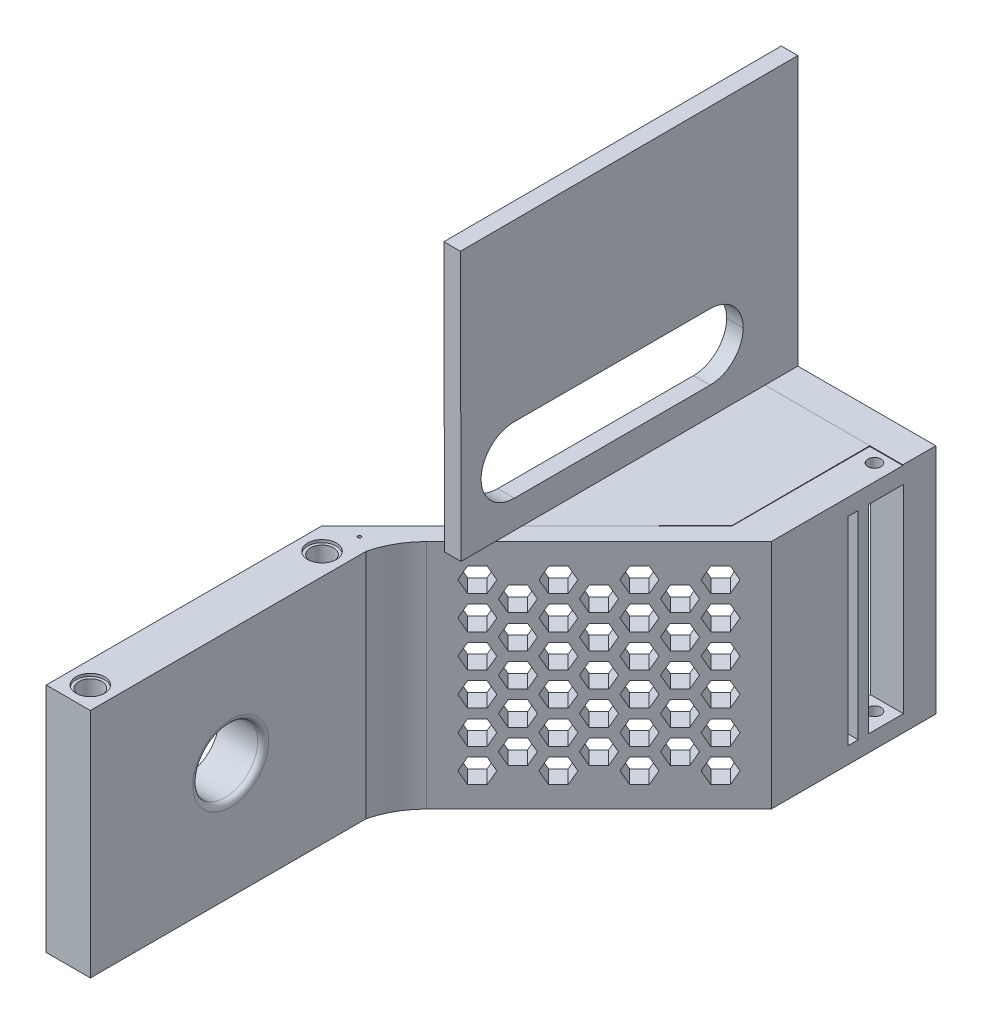
from build123d import *

# Parameters (mm, degrees)
SKETCH1_W            = 25
SKETCH1_H            = 50
SKETCH1_R            = 3.4
BOSS_EXTRUDE1_DEPTH  = 3
SKETCH2_W            = 50
SKETCH2_H            = 3
BOSS_EXTRUDE2_DEPTH  = 8
SKETCH3_W            = 8
SKETCH3_H            = 50
BOSS_EXTRUDE3_DEPTH  = 42
SKETCH4_R            = 2.65
CUT_EXTRUDE1_DEPTH   = 0.5
SKETCH5_R            = 5.888972746
CUT_EXTRUDE2_DEPTH   = 9
FILLET2_R            = 1
SKETCH6_R            = 12.6
BOSS_EXTRUDE4_DEPTH  = 2
FILLET4_R            = 1
SKETCH8_R            = 1.589780168
SKETCH8_R_2          = 1.777428262
CUT_EXTRUDE3_DEPTH   = 10
SKETCH9_W            = 49.021678163
SKETCH9_H            = 20.976854622
CUT_EXTRUDE4_DEPTH   = 68.79439129
SKETCH11_R           = 2.1
CUT_EXTRUDE5_DEPTH   = 59.480168703
SKETCH14_R           = 2.6
CUT_EXTRUDE6_DEPTH   = 0.5
BOSS_EXTRUDE5_DEPTH  = 42
FILLET5_R            = 15
BOSS_EXTRUDE6_DEPTH  = 42
SKETCH17_W           = 55.081474993
SKETCH17_H           = 48.753311723
BOSS_EXTRUDE7_DEPTH  = 3
BOSS_EXTRUDE8_DEPTH  = 2
FILL_START           = -39.593416363
FILL_PATTERN1_DEPTH  = 4.479865946
SKETCH27_W           = 7.5
SKETCH27_H           = 36
CUT_EXTRUDE11_DEPTH  = 117.155303663
SKETCH28_R           = 1.2
CUT_EXTRUDE12_DEPTH  = 113.83644218
SKETCH29_W           = 6
SKETCH29_H           = 42
BOSS_EXTRUDE11_DEPTH = 5.87
CHAMFER1_SIZE        = 4
SKETCH30_R           = 0.3
CUT_EXTRUDE13_DEPTH  = 118.999595961
SKETCH31_W           = 1.8
SKETCH31_H           = 36
CUT_EXTRUDE14_DEPTH  = 10
BOSS_EXTRUDE13_REACH = 132.206
SKETCH33_W           = 28
SKETCH33_H           = 1.999994694
BOSS_EXTRUDE14_REACH = 126.717
SKETCH34_W           = 3
SKETCH34_H           = 48.753311723
SKETCH35_W           = 54.914706507
SKETCH35_H           = 12
CUT_EXTRUDE15_DEPTH  = 4
SKETCH36_W           = 3
SKETCH36_H           = 12
BOSS_EXTRUDE15_DEPTH = 7.4
FILLET6_R            = 6


# Read off the part's stored shape, not the designer's step: Fill Pattern1
# Some blends are built 0.0001 mm under size
with BuildPart() as part:
    # Sketch1 → Boss-Extrude1 (new body)
    with BuildSketch(Plane(origin=(0, 0, 0), x_dir=(1, 0, 0), z_dir=(0, 1, 0))):
        with Locations((2.276951673, 11.384758364)):
            Rectangle(SKETCH1_W, SKETCH1_H)
        with Locations(Location((1.276951673, 11.384758364, 0), (0, 0, 270))):
            Circle(SKETCH1_R, mode=Mode.SUBTRACT)
    extrude(amount=BOSS_EXTRUDE1_DEPTH)

    # Sketch2 → Boss-Extrude2 (add)
    with BuildSketch(Plane.ZY.offset(10.223048327)):
        with Locations((-11.384758364, 1.5)):
            Rectangle(SKETCH2_W, SKETCH2_H)
    extrude(amount=BOSS_EXTRUDE2_DEPTH)

    # Sketch3 → Boss-Extrude3 (add)
    with BuildSketch(Plane.XZ):
        with Locations((-14.223048327, -11.384758364)):
            Rectangle(SKETCH3_W, SKETCH3_H)
    extrude(amount=BOSS_EXTRUDE3_DEPTH)

    # Sketch4 → Cut-Extrude1 (cut)
    with BuildSketch(Plane(origin=(0, 3, 0), x_dir=(1, 0, 0), z_dir=(0, 1, 0))):
        with Locations(Location((-14.223048327, 32.384758364, 0), (0, 0, 270))):
            Circle(SKETCH4_R)
        with Locations(Location((-14.223048327, -9.615241636, 0), (0, 0, 270))):
            Circle(SKETCH4_R)
    cut_extrude1 = extrude(amount=-CUT_EXTRUDE1_DEPTH, mode=Mode.SUBTRACT)

    # Mirror1: Cut-Extrude1 across plane
    add(cut_extrude1.mirror(Plane.ZX.offset(-19.5)), mode=Mode.SUBTRACT)

    # Sketch5 → Cut-Extrude2 (cut)
    with BuildSketch(Plane.ZY.offset(18.223048327)):
        with Locations((-11.836279124, -21)):
            Circle(SKETCH5_R)
    extrude(amount=-CUT_EXTRUDE2_DEPTH, mode=Mode.SUBTRACT)

    # Fillet2
    fillet2_edges = [part.edges().sort_by_distance(p)[0] for p in [
        (-10.223048327, -21, -17.72525187),
    ]]
    fillet(fillet2_edges, radius=FILLET2_R)

    # Mirror2: Cut-Extrude1 across plane
    add(cut_extrude1.mirror(Plane.ZY.offset(1.723048327)), mode=Mode.SUBTRACT)

    # Sketch6 → Boss-Extrude4 (add)
    with BuildSketch(Plane(origin=(0, 3, 0), x_dir=(1, 0, 0), z_dir=(0, 1, 0))):
        with BuildLine():
            Line((14.776951673, 5.825082115), (14.776951673, 16.944434614))
            ThreePointArc((14.776951673, 16.944434614), (-13.323048327, 11.384758364), (14.776951673, 5.825082115))
        make_face()
        with Locations(Location((1.276951673, 11.384758364, 0), (0, 0, 270))):
            Circle(SKETCH6_R, mode=Mode.SUBTRACT)
    extrude(amount=BOSS_EXTRUDE4_DEPTH)

    # Fillet4
    # the kernel refuses this fillet: 1 mm, written as the material it takes off along each edge
    with BuildSketch(Plane(origin=(14.776951673, 5, -3.325082115), x_dir=(0, -1, 0), z_dir=(0, 0, -1))) as fillet4_piece_1:
        with BuildLine():
            CenterArc((FILLET4_R, FILLET4_R), FILLET4_R, 180, 90)
            Line((0, FILLET4_R), (0, 0))
            Line((0, 0), (FILLET4_R, 0))
        make_face()
    extrude(amount=16.119352499, mode=Mode.SUBTRACT)

    # Sketch8 → Cut-Extrude3 (cut)
    with BuildSketch(Plane(origin=(0, 3, 0), x_dir=(1, 0, 0), z_dir=(0, 1, 0))):
        with Locations(Location((1.276951673, 19.884758364, 0), (0, 0, 270))):
            Circle(SKETCH8_R)
        with Locations(Location((1.276951673, 2.884758364, 0), (0, 0, 270))):
            Circle(SKETCH8_R_2)
    extrude(amount=-CUT_EXTRUDE3_DEPTH, mode=Mode.SUBTRACT)

    # Sketch9 → Cut-Extrude4 (cut, through all)
    with BuildSketch(Plane.XY.offset(13.615241636)):
        with Locations((-9.733887409, 10.488427311)):
            Rectangle(SKETCH9_W, SKETCH9_H)
    extrude(amount=-CUT_EXTRUDE4_DEPTH, mode=Mode.SUBTRACT)

    # Sketch11 → Cut-Extrude5 (cut, through all)
    with BuildSketch(Plane(origin=(0, 0, 0), x_dir=(1, 0, 0), z_dir=(0, 1, 0))):
        with Locations(Location((-14.223048327, 32.384758364, 0), (0, 0, 270))):
            Circle(SKETCH11_R)
    cut_extrude5 = extrude(amount=-CUT_EXTRUDE5_DEPTH, mode=Mode.SUBTRACT)

    # Mirror3: Cut-Extrude5 across plane
    add(cut_extrude5.mirror(Plane.XY.offset(-11.384758364)), mode=Mode.SUBTRACT)

    # Sketch14 → Cut-Extrude6 (cut)
    with BuildSketch(Plane(origin=(0, 0, 0), x_dir=(1, 0, 0), z_dir=(0, 1, 0))):
        with Locations(Location((-14.223048327, -9.615241636, 0), (0, 0, 270))):
            Circle(SKETCH14_R)
    cut_extrude6 = extrude(amount=-CUT_EXTRUDE6_DEPTH, mode=Mode.SUBTRACT)

    # Mirror4: Cut-Extrude6 across plane
    add(cut_extrude6.mirror(Plane.XY.offset(-11.384758364)), mode=Mode.SUBTRACT)

    # Sketch15 → Boss-Extrude5 (add)
    with BuildSketch(Plane(origin=(0, 0, 0), x_dir=(1, 0, 0), z_dir=(0, 1, 0))):
        Polygon((-18.223048327, 36.384758364), (24.976951673, 79.584758364), (24.976951673, 74.635010896), (-13.273300859, 36.384758364), align=None)
    extrude(amount=-BOSS_EXTRUDE5_DEPTH)

    # Fillet5
    # the kernel refuses this fillet: 15 mm, written as the material it adds along each edge
    with BuildSketch(Plane(origin=(-13.273300859, 0, -36.384758364), x_dir=(1, 0, 0), z_dir=(0, -1, 0))) as fillet5_piece_1:
        with BuildLine():
            CenterArc((17.611399837, 3.601803599), FILLET5_R, 193.893637127, 31.106362873)
            Line((7.004798119, -7.004798119), (0, 0))
            Line((0, 0), (3.050252532, 0))
        make_face()
    extrude(amount=42)

    # Sketch16 → Boss-Extrude6 (add)
    with BuildSketch(Plane(origin=(0, 0, 0), x_dir=(1, 0, 0), z_dir=(0, 1, 0))):
        Polygon((18.976951673, 73.584758364), (18.976951673, 98.584758364), (24.976951673, 98.584758364), (24.976951673, 79.584758364), align=None)
    extrude(amount=-BOSS_EXTRUDE6_DEPTH)



with BuildPart() as body_2:
    # Sketch17 → Boss-Extrude7 (new body)
    with BuildSketch(Plane(origin=(-0.023048327, -88.270826713, 236.630045038), x_dir=(0, 0.002303401717977271, -0.999997347166744), z_dir=(1, 0, 0))):
        with Locations((307.762919346, 112.002250776)):
            Rectangle(SKETCH17_W, SKETCH17_H)
    extrude(amount=-BOSS_EXTRUDE7_DEPTH)


with BuildPart() as part_1:
    add(part.part)

    add(body_2.part)  # Boss-Extrude8 merges body 2
    # Sketch18 → Boss-Extrude8 (add)
    with BuildSketch(Plane(origin=(0, -0.099943314, -0.00023021), x_dir=(1, 0, 0), z_dir=(0, -0.9999973471667442, -0.0023034017179773937))):
        Polygon((-3.023048327, -98.470916371), (-3.023048327, -51.487878646), (18.976951673, -73.487820284), (18.976951673, -98.487753963), (-3.023048327, -98.487753963), align=None)
    extrude(amount=BOSS_EXTRUDE8_DEPTH)

    # Fill Pattern1 outline → Fill Pattern1 (cut)
    with BuildSketch(Plane(origin=(0, 0, 0), x_dir=(0.7071067811865457, 0, -0.7071067811865495), z_dir=(0.7071067811865493, 0, 0.7071067811865458)).offset(FILL_START)):
        Polygon((30.253964255, -6), (31.503964255, -8.165063509), (34.003964255, -8.165063509), (35.253964255, -6), (34.003964255, -3.834936491), (31.503964255, -3.834936491), align=None)
        Polygon((45.842421523, -33), (47.092421523, -35.165063509), (49.592421523, -35.165063509), (50.842421523, -33), (49.592421523, -30.834936491), (47.092421523, -30.834936491), align=None)
        Polygon((40.6462691, -24), (41.8962691, -26.165063509), (44.3962691, -26.165063509), (45.6462691, -24), (44.3962691, -21.834936491), (41.8962691, -21.834936491), align=None)
        Polygon((35.450116678, -15), (36.700116678, -17.165063509), (39.200116678, -17.165063509), (40.450116678, -15), (39.200116678, -12.834936491), (36.700116678, -12.834936491), align=None)
        Polygon((52.288573946, -8.165063509), (54.788573946, -8.165063509), (56.038573946, -6), (54.788573946, -3.834936491), (52.288573946, -3.834936491), (51.038573946, -6), align=None)
        Polygon((41.8962691, -8.165063509), (44.3962691, -8.165063509), (45.6462691, -6), (44.3962691, -3.834936491), (41.8962691, -3.834936491), (40.6462691, -6), align=None)
        Polygon((62.680878791, -8.165063509), (65.180878791, -8.165063509), (66.430878791, -6), (65.180878791, -3.834936491), (62.680878791, -3.834936491), (61.430878791, -6), align=None)
        Polygon((30.253964255, -24), (31.503964255, -26.165063509), (34.003964255, -26.165063509), (35.253964255, -24), (34.003964255, -21.834936491), (31.503964255, -21.834936491), align=None)
        Polygon((35.450116678, -33), (36.700116678, -35.165063509), (39.200116678, -35.165063509), (40.450116678, -33), (39.200116678, -30.834936491), (36.700116678, -30.834936491), align=None)
        Polygon((62.680878791, -26.165063509), (65.180878791, -26.165063509), (66.430878791, -24), (65.180878791, -21.834936491), (62.680878791, -21.834936491), (61.430878791, -24), align=None)
        Polygon((52.288573946, -26.165063509), (54.788573946, -26.165063509), (56.038573946, -24), (54.788573946, -21.834936491), (52.288573946, -21.834936491), (51.038573946, -24), align=None)
        Polygon((57.484726369, -35.165063509), (59.984726369, -35.165063509), (61.234726369, -33), (59.984726369, -30.834936491), (57.484726369, -30.834936491), (56.234726369, -33), align=None)
        Polygon((49.592421523, -17.165063509), (50.842421523, -15), (49.592421523, -12.834936491), (47.092421523, -12.834936491), (45.842421523, -15), (47.092421523, -17.165063509), align=None)
        Polygon((35.450116678, -27), (36.700116678, -29.165063509), (39.200116678, -29.165063509), (40.450116678, -27), (39.200116678, -24.834936491), (36.700116678, -24.834936491), align=None)
        Polygon((30.253964255, -18), (31.503964255, -20.165063509), (34.003964255, -20.165063509), (35.253964255, -18), (34.003964255, -15.834936491), (31.503964255, -15.834936491), align=None)
        Polygon((40.6462691, -36), (41.8962691, -38.165063509), (44.3962691, -38.165063509), (45.6462691, -36), (44.3962691, -33.834936491), (41.8962691, -33.834936491), align=None)
        Polygon((57.484726369, -29.165063509), (59.984726369, -29.165063509), (61.234726369, -27), (59.984726369, -24.834936491), (57.484726369, -24.834936491), (56.234726369, -27), align=None)
        Polygon((47.092421523, -29.165063509), (49.592421523, -29.165063509), (50.842421523, -27), (49.592421523, -24.834936491), (47.092421523, -24.834936491), (45.842421523, -27), align=None)
        Polygon((34.003964255, -38.165063509), (35.253964255, -36), (34.003964255, -33.834936491), (31.503964255, -33.834936491), (30.253964255, -36), (31.503964255, -38.165063509), align=None)
        Polygon((49.592421523, -11.165063509), (50.842421523, -9), (49.592421523, -6.834936491), (47.092421523, -6.834936491), (45.842421523, -9), (47.092421523, -11.165063509), align=None)
        Polygon((44.3962691, -20.165063509), (45.6462691, -18), (44.3962691, -15.834936491), (41.8962691, -15.834936491), (40.6462691, -18), (41.8962691, -20.165063509), align=None)
        Polygon((35.450116678, -21), (36.700116678, -23.165063509), (39.200116678, -23.165063509), (40.450116678, -21), (39.200116678, -18.834936491), (36.700116678, -18.834936491), align=None)
        Polygon((30.253964255, -12), (31.503964255, -14.165063509), (34.003964255, -14.165063509), (35.253964255, -12), (34.003964255, -9.834936491), (31.503964255, -9.834936491), align=None)
        Polygon((40.6462691, -30), (41.8962691, -32.165063509), (44.3962691, -32.165063509), (45.6462691, -30), (44.3962691, -27.834936491), (41.8962691, -27.834936491), align=None)
        Polygon((57.484726369, -23.165063509), (59.984726369, -23.165063509), (61.234726369, -21), (59.984726369, -18.834936491), (57.484726369, -18.834936491), (56.234726369, -21), align=None)
        Polygon((47.092421523, -23.165063509), (49.592421523, -23.165063509), (50.842421523, -21), (49.592421523, -18.834936491), (47.092421523, -18.834936491), (45.842421523, -21), align=None)
        Polygon((34.003964255, -32.165063509), (35.253964255, -30), (34.003964255, -27.834936491), (31.503964255, -27.834936491), (30.253964255, -30), (31.503964255, -32.165063509), align=None)
        Polygon((44.3962691, -14.165063509), (45.6462691, -12), (44.3962691, -9.834936491), (41.8962691, -9.834936491), (40.6462691, -12), (41.8962691, -14.165063509), align=None)
        Polygon((62.680878791, -32.165063509), (65.180878791, -32.165063509), (66.430878791, -30), (65.180878791, -27.834936491), (62.680878791, -27.834936491), (61.430878791, -30), align=None)
        Polygon((52.288573946, -32.165063509), (54.788573946, -32.165063509), (56.038573946, -30), (54.788573946, -27.834936491), (52.288573946, -27.834936491), (51.038573946, -30), align=None)
        Polygon((62.680878791, -38.165063509), (65.180878791, -38.165063509), (66.430878791, -36), (65.180878791, -33.834936491), (62.680878791, -33.834936491), (61.430878791, -36), align=None)
        Polygon((52.288573946, -38.165063509), (54.788573946, -38.165063509), (56.038573946, -36), (54.788573946, -33.834936491), (52.288573946, -33.834936491), (51.038573946, -36), align=None)
        Polygon((56.234726369, -15), (57.484726369, -17.165063509), (59.984726369, -17.165063509), (61.234726369, -15), (59.984726369, -12.834936491), (57.484726369, -12.834936491), align=None)
        Polygon((56.234726369, -9), (57.484726369, -11.165063509), (59.984726369, -11.165063509), (61.234726369, -9), (59.984726369, -6.834936491), (57.484726369, -6.834936491), align=None)
        Polygon((61.430878791, -18), (62.680878791, -20.165063509), (65.180878791, -20.165063509), (66.430878791, -18), (65.180878791, -15.834936491), (62.680878791, -15.834936491), align=None)
        Polygon((36.700116678, -11.165063509), (39.200116678, -11.165063509), (40.450116678, -9), (39.200116678, -6.834936491), (36.700116678, -6.834936491), (35.450116678, -9), align=None)
        Polygon((54.788573946, -20.165063509), (56.038573946, -18), (54.788573946, -15.834936491), (52.288573946, -15.834936491), (51.038573946, -18), (52.288573946, -20.165063509), align=None)
        Polygon((62.680878791, -14.165063509), (65.180878791, -14.165063509), (66.430878791, -12), (65.180878791, -9.834936491), (62.680878791, -9.834936491), (61.430878791, -12), align=None)
        Polygon((52.288573946, -14.165063509), (54.788573946, -14.165063509), (56.038573946, -12), (54.788573946, -9.834936491), (52.288573946, -9.834936491), (51.038573946, -12), align=None)
    extrude(amount=FILL_PATTERN1_DEPTH, mode=Mode.SUBTRACT)

    # Sketch27 → Cut-Extrude11 (cut, through all)
    with BuildSketch(Plane.ZY.offset(-18.976951673)):
        with Locations((-97.834758364, -21)):
            Rectangle(SKETCH27_W, SKETCH27_H)
    extrude(amount=-CUT_EXTRUDE11_DEPTH, mode=Mode.SUBTRACT)

    # Sketch28 → Cut-Extrude12 (cut, through all)
    with BuildSketch(Plane(origin=(0, 0, 0), x_dir=(1, 0, 0), z_dir=(0, 1, 0))):
        with Locations(Location((21.976951673, 96.334758364, 0), (0, 0, 270))):
            Circle(SKETCH28_R)
    extrude(amount=-CUT_EXTRUDE12_DEPTH, mode=Mode.SUBTRACT)

    # Sketch29 → Boss-Extrude11 (add)
    with BuildSketch(Plane(origin=(0, 0, -98.584758364), x_dir=(-1, 0, 0), z_dir=(0, 0, -1))):
        with Locations((-21.976951673, -21)):
            Rectangle(SKETCH29_W, SKETCH29_H)
    extrude(amount=BOSS_EXTRUDE11_DEPTH)

    # Chamfer1
    chamfer1_edges = [part_1.edges().sort_by_distance(p)[0] for p in [
        (18.976951673, -21, -104.454758364),
    ]]
    chamfer(chamfer1_edges, length=CHAMFER1_SIZE)

    # Sketch30 → Cut-Extrude13 (cut, through all)
    with BuildSketch(Plane(origin=(0, 0, 0), x_dir=(1, 0, 0), z_dir=(0, 1, 0))):
        with Locations(Location((-13.114758504, 38.068023801, 0), (0, 0, 270))):
            Circle(SKETCH30_R)
    extrude(amount=-CUT_EXTRUDE13_DEPTH, mode=Mode.SUBTRACT)

    # Sketch31 → Cut-Extrude14 (cut)
    with BuildSketch(Plane(origin=(24.976951673, 0, 0), x_dir=(0, 0, -1), z_dir=(1, 0, 0))):
        with Locations((93.184758364, -21)):
            Rectangle(SKETCH31_W, SKETCH31_H)
        with Locations((89.484758364, -21)):
            Rectangle(SKETCH31_W, SKETCH31_H)
    extrude(amount=-CUT_EXTRUDE14_DEPTH, mode=Mode.SUBTRACT)

    # Boss-Extrude13: up to this plane
    boss_extrude13_end = Plane(origin=(18.976951673, -1.873081146, -98.492329705), z_dir=(0, -0.0023034017179773933, 0.999997347166744))
    # Sketch33 → Boss-Extrude13 (add, up to the surface)
    with BuildSketch(Plane(origin=(0, 0, -104.454758364), x_dir=(-1, 0, 0), z_dir=(0, 0, -1)), mode=Mode.PRIVATE) as boss_extrude13_sk1:
        with Locations((-10.976951673, -0.873083799)):
            Rectangle(SKETCH33_W, SKETCH33_H)
    boss_extrude13_tool1 = split(extrude(boss_extrude13_sk1.sketch, amount=-BOSS_EXTRUDE13_REACH, mode=Mode.PRIVATE), bisect_by=boss_extrude13_end, keep=Keep.BOTH, mode=Mode.PRIVATE)
    add(boss_extrude13_tool1.solids().sort_by_distance((10.976952, -0.873084, -104.454758))[0])

    # Boss-Extrude14: up to this plane
    boss_extrude14_end = Plane(origin=(0, 0, -104.454758364), z_dir=(0, 0, -1))
    # Sketch34 → Boss-Extrude14 (add, up to the surface)
    with BuildSketch(Plane(origin=(0, 0.226818078, -98.470655144), x_dir=(-1, 0, 0), z_dir=(0, 0.0023034017179766083, -0.9999973471667442)), mode=Mode.PRIVATE) as boss_extrude14_sk1:
        with Locations((1.523048327, 24.276712283)):
            Rectangle(SKETCH34_W, SKETCH34_H)
    boss_extrude14_tool1 = split(extrude(boss_extrude14_sk1.sketch, amount=BOSS_EXTRUDE14_REACH, mode=Mode.PRIVATE), bisect_by=boss_extrude14_end, keep=Keep.BOTH, mode=Mode.PRIVATE)
    add(boss_extrude14_tool1.solids().sort_by_distance((-1.523048, 24.503466, -98.414736))[0])

    # Sketch35 → Cut-Extrude15 (cut)
    with BuildSketch(Plane(origin=(-0.023048327, 0, 0), x_dir=(0, 0, -1), z_dir=(1, 0, 0))):
        with Locations((74.482029664, 11.104362504)):
            Rectangle(SKETCH35_W, SKETCH35_H)
    extrude(amount=-CUT_EXTRUDE15_DEPTH, mode=Mode.SUBTRACT)

    # Sketch36 → Boss-Extrude15 (add)
    with BuildSketch(Plane.XY.offset(-101.939382917)):
        with Locations((-1.523048327, 11.104362504)):
            Rectangle(SKETCH36_W, SKETCH36_H)
    extrude(amount=BOSS_EXTRUDE15_DEPTH)

    # Fillet6
    fillet6_edges = [part_1.edges().sort_by_distance(p)[0] for p in [
        (-1.523048327, 17.104362504, -47.02467641),
        (-1.523048327, 5.104362504, -47.02467641),
        (-1.523048327, 5.104362504, -94.539382917),
        (-1.523048327, 17.104362504, -94.539382917),
    ]]
    fillet(fillet6_edges, radius=FILLET6_R - 0.0001)  # a hair under: the kernel refuses the full size


solid = part_1.part
